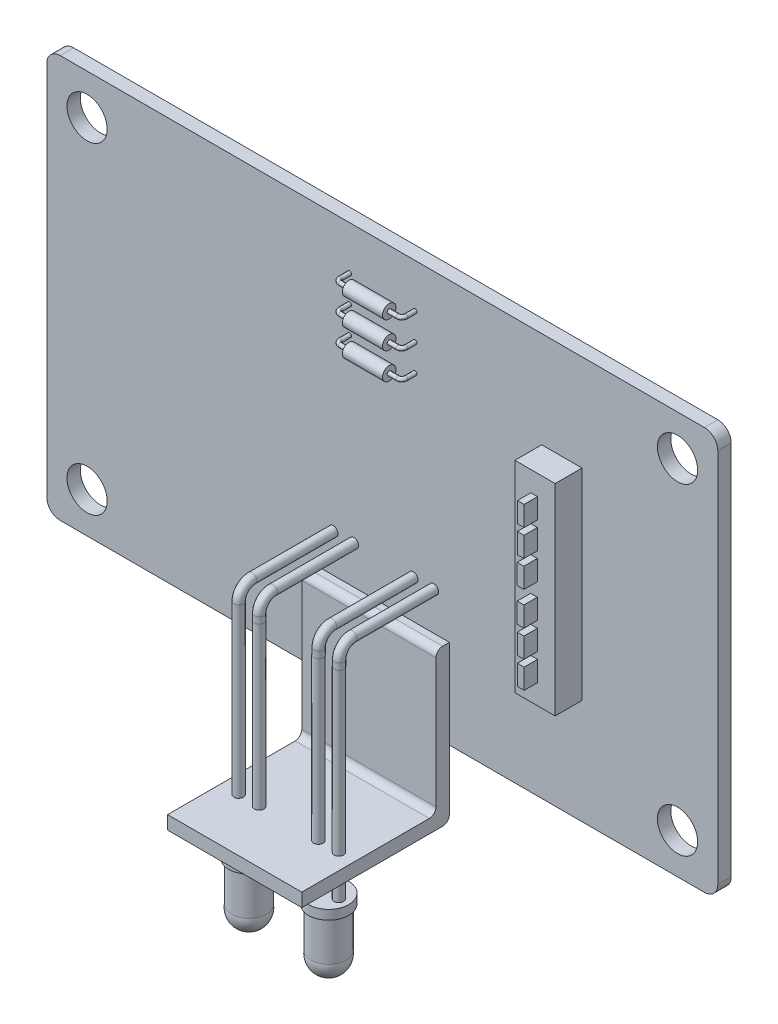
from build123d import *

# Parameters (mm, degrees)
ESQUISSE1_R                          = 1.5
BOSS_EXTRU_1_DEPTH                   = 1
BOSS_EXTRU_2_DEPTH                   = 5
BOSS_EXTRU_2_DEPTH_BACK              = 5
BOSS_EXTRU_3_START                   = 2
ESQUISSE3_R                          = 1.5
BOSS_EXTRU_3_DEPTH                   = 0.7
BOSS_EXTRU_3_2_DEPTH                 = 0.7
ESQUISSE4_R                          = 1.3
BOSS_EXTRU_4_DEPTH                   = 3
ESQUISSE5_R                          = 0.35
BOSS_EXTRU_5_DEPTH                   = 15
ESQUISSE6_R                          = 0.35
R_P_TITION_LIN_AIRE1_COUNT           = 2
R_P_TITION_LIN_AIRE1_PITCH           = 1.53
R_P_TITION_LIN_AIRE2_COUNT           = 2
R_P_TITION_LIN_AIRE2_PITCH           = 5.96
R_P_TITION_LIN_AIRE2_COPY_1_SKETCH_R = 0.35
ESQUISSE7_W                          = 3
ESQUISSE7_H                          = 15
BOSS_EXTRU_6_DEPTH                   = 2
ESQUISSE8_W                          = 0.5
ESQUISSE8_H                          = 1.5
BOSS_EXTRU_7_DEPTH                   = 1
ESQUISSE9_R                          = 0.5
BOSS_EXTRU_8_DEPTH                   = 1.5
ESQUISSE10_R                         = 0.15
R_P_TITION_LIN_AIRE3_COUNT           = 3
R_P_TITION_LIN_AIRE3_PITCH           = 2
R_P_TITION_LIN_AIRE3_COPY_1_SKETCH_R = 0.15
R_P_TITION_LIN_AIRE3_COPY_2_SKETCH_R = 0.15
R_P_TITION_LIN_AIRE4_COUNT           = 3
R_P_TITION_LIN_AIRE4_PITCH           = 2


# Read off the part's stored shape, not the designer's step: Dôme1, Dôme2
with BuildPart() as part:
    # Esquisse1 → Boss.-Extru.1 (new body)
    with BuildSketch(Plane.XY):
        with BuildLine():
            Line((-24, 15), (24, 15))
            ThreePointArc((24, 15), (24.707106781, 14.707106781), (25, 14))
            Line((25, 14), (25, -14))
            ThreePointArc((25, -14), (24.707106781, -14.707106781), (24, -15))
            Line((24, -15), (-24, -15))
            ThreePointArc((-24, -15), (-24.707106781, -14.707106781), (-25, -14))
            Line((-25, -14), (-25, 14))
            ThreePointArc((-25, 14), (-24.707106781, 14.707106781), (-24, 15))
        make_face()
        with Locations((-22, 12)):
            Circle(ESQUISSE1_R, mode=Mode.SUBTRACT)
        with Locations((22, 12)):
            Circle(ESQUISSE1_R, mode=Mode.SUBTRACT)
        with Locations((22, -12)):
            Circle(ESQUISSE1_R, mode=Mode.SUBTRACT)
        with Locations((-22, -12)):
            Circle(ESQUISSE1_R, mode=Mode.SUBTRACT)
    extrude(amount=BOSS_EXTRU_1_DEPTH)

    # Esquisse2 → Boss.-Extru.2 (add, two sides: drawn at the far end of the back side and taken through both)
    with BuildSketch(Plane(origin=(0, 0, 0), x_dir=(0, 0, -1), z_dir=(1, 0, 0)).offset(-BOSS_EXTRU_2_DEPTH_BACK)):
        with BuildLine():
            Line((-1, -8.366145722), (-1.5, -8.366145722))
            ThreePointArc((-1.5, -8.366145722), (-1.853553391, -8.512592331), (-2, -8.866145722))
            Line((-2, -8.866145722), (-2, -18.484413371))
            ThreePointArc((-2, -18.484413371), (-2.146446609, -18.837966761), (-2.5, -18.984413371))
            Line((-2.5, -18.984413371), (-12, -18.984413371))
            Line((-12, -18.984413371), (-12, -19.984413371))
            Line((-12, -19.984413371), (-2, -19.984413371))
            Line((-2, -19.984413371), (-1.5, -19.984413371))
            ThreePointArc((-1.5, -19.984413371), (-1.146446609, -19.837966761), (-1, -19.484413371))
            Line((-1, -19.484413371), (-1, -8.366145722))
        make_face()
    extrude(amount=BOSS_EXTRU_2_DEPTH + BOSS_EXTRU_2_DEPTH_BACK)



with BuildPart() as body_2:
    # Esquisse3 → Boss.-Extru.3 (new body)
    with BuildSketch(Plane.XZ.offset(19.984413371).offset(BOSS_EXTRU_3_START)):
        with Locations(Location((-2.883718091, 8.053616468, 0), (0, 0, 270))):
            Circle(ESQUISSE3_R)
    extrude(amount=BOSS_EXTRU_3_DEPTH)



with BuildPart() as body_3:
    # Esquisse3 → Boss.-Extru.3 2 (new body)
    with BuildSketch(Plane.XZ.offset(19.984413371).offset(BOSS_EXTRU_3_START)):
        with Locations(Location((3.053683826, 8.053616468, 0), (0, 0, 270))):
            Circle(ESQUISSE3_R)
    extrude(amount=BOSS_EXTRU_3_2_DEPTH)


with BuildPart() as body_2_1:
    add(body_2.part)

    add(body_3.part)  # Boss.-Extru.4 merges body 3
    # Esquisse4 → Boss.-Extru.4 (add)
    with BuildSketch(Plane.XZ.offset(22.684413371)):
        with Locations(Location((-2.883718091, 8.053616468, 0), (0, 0, 270))):
            Circle(ESQUISSE4_R)
        with Locations(Location((3.053683826, 8.053616468, 0), (0, 0, 270))):
            Circle(ESQUISSE4_R)
    extrude(amount=BOSS_EXTRU_4_DEPTH)

    # Dôme1 outline → Dôme1 (revolve)
    with BuildSketch(Plane(origin=(3.053683826, 0, 8.053616468), x_dir=(1, 0, 0), z_dir=(0, 0, 1))):
        with BuildLine():
            Line((0, -25.684413369), (0, -27.184413371))
            ThreePointArc((0, -27.184413371), (0.992471662, -26.731222144), (1.3, -25.68441337))
            Line((1.3, -25.68441337), (0, -25.684413369))
        make_face()
    revolve(axis=Axis((3.053683826, 0, 8.053616468), (0, 1, 0)))

    # Dôme2 outline → Dôme2 (revolve)
    with BuildSketch(Plane(origin=(-2.883718091, 0, 8.053616468), x_dir=(1, 0, 0), z_dir=(0, 0, 1))):
        with BuildLine():
            Line((0, -25.684413369), (0, -27.184413371))
            ThreePointArc((0, -27.184413371), (0.992471662, -26.731222144), (1.3, -25.68441337))
            Line((1.3, -25.68441337), (0, -25.684413369))
        make_face()
    revolve(axis=Axis((-2.883718091, 0, 8.053616468), (0, 1, 0)))


with BuildPart() as part_1:
    add(part.part)

    add(body_2_1.part)  # Boss.-Extru.5 merges body 2
    # Esquisse5 → Boss.-Extru.5 (add)
    with BuildSketch(Plane(origin=(0, -21.984413371, 0), x_dir=(1, 0, 0), z_dir=(0, 1, 0))):
        with Locations(Location((-2.119173686, -8.053616468, 0), (0, 0, 270))):
            Circle(ESQUISSE5_R)
        with Locations(Location((-3.648262497, -8.053616468, 0), (0, 0, 90))):
            Circle(ESQUISSE5_R)
        with Locations(Location((3.818228231, -8.053616468, 0), (0, 0, 270))):
            Circle(ESQUISSE5_R)
        with Locations(Location((2.289139421, -8.053616468, 0), (0, 0, 90))):
            Circle(ESQUISSE5_R)
    extrude(amount=BOSS_EXTRU_5_DEPTH)

    # Balayage1: sweep along a curve in space
    with BuildLine() as balayage1_path:
        Line((-3.648262497, -6.984413371, 8.053616468), (-3.648262497, -6.50826016, 8.053616468))
        ThreePointArc((-3.648262497, -6.50826016, 8.053616468), (-3.648262497, -5.801153379, 7.760723249), (-3.648262497, -5.50826016, 7.053616468))
        Line((-3.648262497, -5.50826016, 7.053616468), (-3.648262497, -5.50826016, -0.299163355))
    # Esquisse6 → Balayage1 (sweep)
    with BuildSketch(Plane(origin=(0, -6.984413371, 0), x_dir=(1, 0, 0), z_dir=(0, 1, 0))):
        with Locations((-3.648262497, -8.053616468)):
            Circle(ESQUISSE6_R)
    balayage1 = sweep(path=balayage1_path.line)

    # Répétition linéaire1: Balayage1 ×2
    with Locations(*[(i * R_P_TITION_LIN_AIRE1_PITCH, 0, 0) for i in range(1, R_P_TITION_LIN_AIRE1_COUNT)]):
        add(balayage1)

    # Répétition linéaire2: Balayage1 ×2
    with Locations(*[(i * R_P_TITION_LIN_AIRE2_PITCH, 0, 0) for i in range(1, R_P_TITION_LIN_AIRE2_COUNT)]):
        add(balayage1)

    # Répétition linéaire2 copy 1: sweep along a curve in space
    with BuildLine() as r_p_tition_lin_aire2_copy_1_path:
        Line((3.841737503, -6.984413371, 8.053616468), (3.841737503, -6.50826016, 8.053616468))
        ThreePointArc((3.841737503, -6.50826016, 8.053616468), (3.841737503, -5.801153379, 7.760723249), (3.841737503, -5.50826016, 7.053616468))
        Line((3.841737503, -5.50826016, 7.053616468), (3.841737503, -5.50826016, -0.299163355))
    # Répétition linéaire2 copy 1 sketch → Répétition linéaire2 copy 1 (sweep)
    with BuildSketch(Plane(origin=(7.49, -6.984413371, 0), x_dir=(1, 0, 0), z_dir=(0, 1, 0))):
        with Locations((-3.648262497, -8.053616468)):
            Circle(R_P_TITION_LIN_AIRE2_COPY_1_SKETCH_R)
    sweep(path=r_p_tition_lin_aire2_copy_1_path.line)

    # Esquisse7 → Boss.-Extru.6 (add)
    with BuildSketch(Plane.XY.offset(1)):
        with Locations((13.381076473, 0.323588618)):
            Rectangle(ESQUISSE7_W, ESQUISSE7_H)
    extrude(amount=BOSS_EXTRU_6_DEPTH)

    # Esquisse8 → Boss.-Extru.7 (add)
    with BuildSketch(Plane.XY.offset(3)):
        with Locations((13.30163416, 1.573588618)):
            Rectangle(ESQUISSE8_W, ESQUISSE8_H)
        with Locations((13.3117829, 3.573562868)):
            Rectangle(ESQUISSE8_W, ESQUISSE8_H)
        with Locations((13.32193164, 5.573537119)):
            Rectangle(ESQUISSE8_W, ESQUISSE8_H)
        with Locations((13.32193164, -4.926359884)):
            Rectangle(ESQUISSE8_W, ESQUISSE8_H)
        with Locations((13.3117829, -2.926385633)):
            Rectangle(ESQUISSE8_W, ESQUISSE8_H)
        with Locations((13.30163416, -0.926411382)):
            Rectangle(ESQUISSE8_W, ESQUISSE8_H)
    extrude(amount=BOSS_EXTRU_7_DEPTH)



with BuildPart() as body_2_2:
    # Esquisse9 → Boss.-Extru.8 (new, symmetric)
    with BuildSketch(Plane(origin=(0, 0, 0), x_dir=(0, 0, -1), z_dir=(1, 0, 0))):
        with Locations((-1.982663386, 11.738719875)):
            Circle(ESQUISSE9_R)
    boss_extru_8 = extrude(amount=BOSS_EXTRU_8_DEPTH, both=True)


with BuildPart() as part_2:
    add(part_1.part)

    add(body_2_2.part)  # Balayage2 merges body 2 2
    # Balayage2: sweep along a curve in space
    with BuildLine() as balayage2_path:
        Line((1.5, 11.738719875, 1.982663386), (2.141725899, 11.738719875, 1.982663386))
        ThreePointArc((2.141725899, 11.738719875, 1.982663386), (2.353857933, 11.738719875, 1.89479542), (2.441725899, 11.738719875, 1.682663386))
        Line((2.441725899, 11.738719875, 1.682663386), (2.441725899, 11.738719875, 0.931388588))
    # Esquisse10 → Balayage2 (sweep)
    with BuildSketch(Plane(origin=(1.5, 0, 0), x_dir=(0, 0, -1), z_dir=(1, 0, 0))):
        with Locations((-1.982663386, 11.738719875)):
            Circle(ESQUISSE10_R)
    balayage2 = sweep(path=balayage2_path.line)

    # Symétrie1: Balayage2 across plane
    add(balayage2.mirror(Plane(origin=(0, 0, 0), x_dir=(0, 0, 1), z_dir=(1, 0, 0))))

    # Répétition linéaire3: Balayage2 ×3
    with Locations(*[(0, -i * R_P_TITION_LIN_AIRE3_PITCH, 0) for i in range(1, R_P_TITION_LIN_AIRE3_COUNT)]):
        add(balayage2)

    # Répétition linéaire3 copy 1: sweep along a curve in space
    with BuildLine() as r_p_tition_lin_aire3_copy_1_path:
        Line((-1.5, 9.738719875, 1.982663386), (-2.141725899, 9.738719875, 1.982663386))
        ThreePointArc((-2.141725899, 9.738719875, 1.982663386), (-2.353857933, 9.738719875, 1.89479542), (-2.441725899, 9.738719875, 1.682663386))
        Line((-2.441725899, 9.738719875, 1.682663386), (-2.441725899, 9.738719875, 0.931388588))
    # Répétition linéaire3 copy 1 sketch → Répétition linéaire3 copy 1 (sweep)
    with BuildSketch(Plane(origin=(-1.5, -2, 0), x_dir=(0, 0, -1), z_dir=(-1, 0, 0))):
        with Locations((-1.982663386, -11.738719875)):
            Circle(R_P_TITION_LIN_AIRE3_COPY_1_SKETCH_R)
    sweep(path=r_p_tition_lin_aire3_copy_1_path.line)

    # Répétition linéaire3 copy 2: sweep along a curve in space
    with BuildLine() as r_p_tition_lin_aire3_copy_2_path:
        Line((-1.5, 7.738719875, 1.982663386), (-2.141725899, 7.738719875, 1.982663386))
        ThreePointArc((-2.141725899, 7.738719875, 1.982663386), (-2.353857933, 7.738719875, 1.89479542), (-2.441725899, 7.738719875, 1.682663386))
        Line((-2.441725899, 7.738719875, 1.682663386), (-2.441725899, 7.738719875, 0.931388588))
    # Répétition linéaire3 copy 2 sketch → Répétition linéaire3 copy 2 (sweep)
    with BuildSketch(Plane(origin=(-1.5, -4, 0), x_dir=(0, 0, -1), z_dir=(-1, 0, 0))):
        with Locations((-1.982663386, -11.738719875)):
            Circle(R_P_TITION_LIN_AIRE3_COPY_2_SKETCH_R)
    sweep(path=r_p_tition_lin_aire3_copy_2_path.line)

    # Répétition linéaire4: Boss.-Extru.8 ×3
    with Locations(*[(0, -i * R_P_TITION_LIN_AIRE4_PITCH, 0) for i in range(1, R_P_TITION_LIN_AIRE4_COUNT)]):
        add(boss_extru_8)


solid = part_2.part
